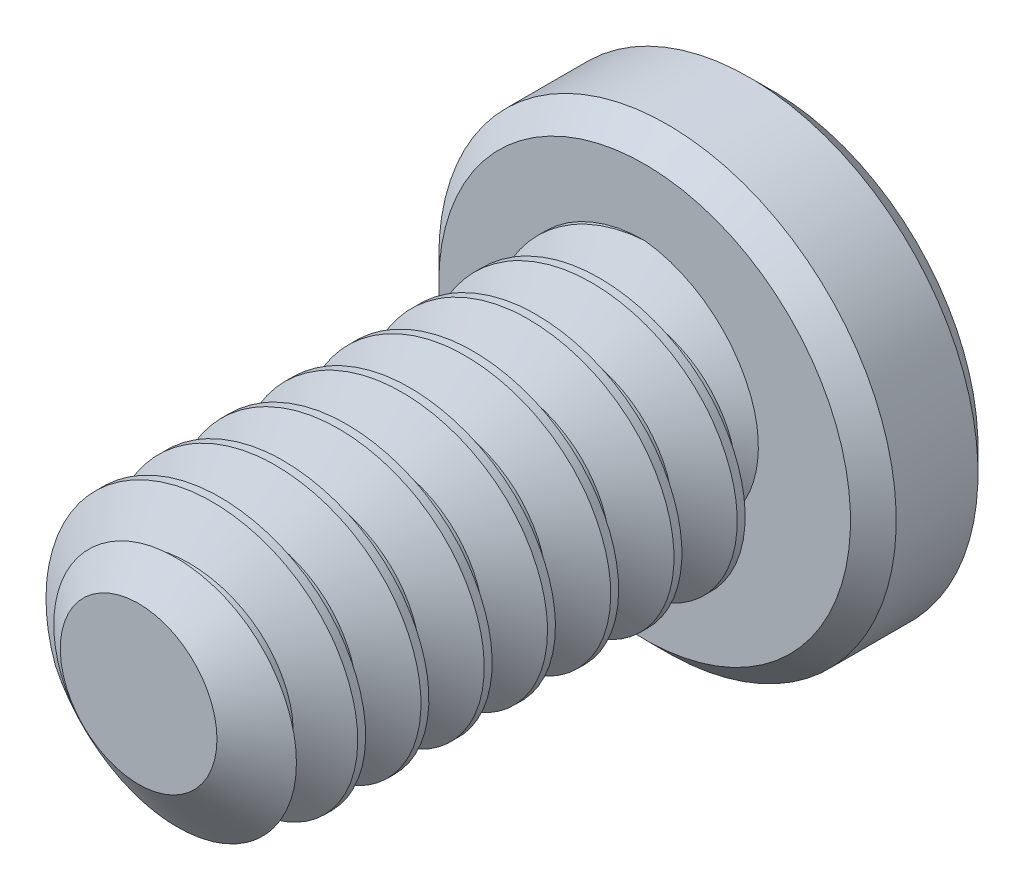
from build123d import *

# Parameters (mm, degrees)
SKETCH1_R          = 1.7526
EXTRUDE1_DEPTH     = 6.35
CUT_SWEEP1_PITCH   = 0.79375
SKETCH6_R          = 2.8702
EXTRUDE2_DEPTH     = 1.6002
CUT_EXTRUDE1_DEPTH = 1.190625
CHAMFER1_SIZE      = 0.28702


with BuildPart() as part:
    # Sketch1 → Extrude1 (new body)
    with BuildSketch(Plane.XY):
        Circle(SKETCH1_R)
    extrude(amount=-EXTRUDE1_DEPTH)

    # Cut-Sweep1: the profile of Sketch3 profile screwed along a right-hand helix of 9 turns, 6 arcs to a turn; built about Z, then put on its axis
    cut_sweep1_z = Axis((0, 0, 0), (0, 0, 1))
    cut_sweep1_corners = [(1.7529, 0, -0.694704455), (1.237044252, 0, -0.396875), (1.237044252, 0, -0.29765625), (1.7529, 0, 0.000173205)]
    with BuildLine(mode=Mode.PRIVATE) as cut_sweep1_profile:
        Line(cut_sweep1_corners[0], cut_sweep1_corners[1])
        Line(cut_sweep1_corners[1], cut_sweep1_corners[2])
        Line(cut_sweep1_corners[2], cut_sweep1_corners[3])
        Line(cut_sweep1_corners[3], cut_sweep1_corners[0])
    cut_sweep1_cap = Face(cut_sweep1_profile.wire())
    cut_sweep1_turn_angles = [0, 30, 60, 90, 120, 150, 180, 210, 240, 270, 300, 330, 360]
    cut_sweep1_turn_weights = [1, 0.8660254037844387, 1, 0.8660254037844387, 1, 0.8660254037844387, 1, 0.8660254037844387, 1, 0.8660254037844387, 1, 0.8660254037844387, 1]
    cut_sweep1_turn_rails = [Edge.make_bspline([Vector(p[0], p[1], 0).rotate(cut_sweep1_z, cut_sweep1_turn_angles[k]) / cut_sweep1_turn_weights[k] + Vector(0, 0, p[2] + CUT_SWEEP1_PITCH * cut_sweep1_turn_angles[k] / 360) for k in range(13)], [0, 0, 0, 1, 1, 2, 2, 3, 3, 4, 4, 5, 5, 6, 6, 6], 2, cut_sweep1_turn_weights) for p in cut_sweep1_corners]
    cut_sweep1_turn_sides = [Face.make_surface_from_curves(cut_sweep1_turn_rails[p[0]], cut_sweep1_turn_rails[p[1]]) for p in [(0, 1), (1, 2), (2, 3), (3, 0)]]
    cut_sweep1 = Plane(origin=(0, 0, 0), x_dir=(0, 1, 0), z_dir=(0, 0, -1)) * Solid(Shell([*[p.moved(Location((0, 0, CUT_SWEEP1_PITCH * i))) for i in range(9) for p in cut_sweep1_turn_sides], cut_sweep1_cap, cut_sweep1_cap.rotate(cut_sweep1_z, 3240).moved(Location((0, 0, CUT_SWEEP1_PITCH * 3240 / 360)))]))
    add(cut_sweep1, mode=Mode.SUBTRACT)

    # Sketch4 → Cut-Revolve1 (revolve, cut)
    with BuildSketch(Plane(origin=(0, 0, 0), x_dir=(0, 0, -1), z_dir=(1, 0, 0)), mode=Mode.PRIVATE) as cut_revolve1_sk:
        Polygon((0.538848736, 1.7526), (0, 0.983044252), (0, 1.7526), align=None)
    revolve(cut_revolve1_sk.sketch.rotate(Axis((0, 0, 0), (0, 0, -1)), 261.048315518), axis=Axis((0, 0, 0), (0, 0, -1)), mode=Mode.SUBTRACT)

    # Sketch6 → Extrude2 (add)
    with BuildSketch(Plane(origin=(0, 0, -6.35), x_dir=(-1, 0, 0), z_dir=(0, 0, -1))):
        Circle(SKETCH6_R)
    extrude(amount=EXTRUDE2_DEPTH)

    # Sketch7 → Cut-Extrude1 (cut)
    with BuildSketch(Plane(origin=(0, 0, -7.9502), x_dir=(-1, 0, 0), z_dir=(0, 0, -1))):
        Polygon((0, 0.916543552), (-0.79375, 0.458271776), (-0.79375, -0.458271776), (0, -0.916543552), (0.79375, -0.458271776), (0.79375, 0.458271776), align=None)
    extrude(amount=-CUT_EXTRUDE1_DEPTH, mode=Mode.SUBTRACT)

    # Cut-Extrude2 cone 1 section (through the dimple's axis) → Cut-Extrude2 (revolve, cut)
    with BuildSketch(Plane(origin=(0, 0, -7.9502), x_dir=(0, 1, 0), z_dir=(1, 0, 0))):
        Polygon((0, 0), (0.916543552, 0), (0, 0.916543552), align=None)
    revolve(axis=Axis((0, 0, -7.9502), (0, 0, 1)), mode=Mode.SUBTRACT)

    # Chamfer1
    chamfer1_edges = [part.edges().sort_by_distance(p)[0] for p in [
        (2.8702, 0, -6.35),
        (2.8702, 0, -7.9502),
    ]]
    chamfer(chamfer1_edges, length=CHAMFER1_SIZE)


solid = part.part
